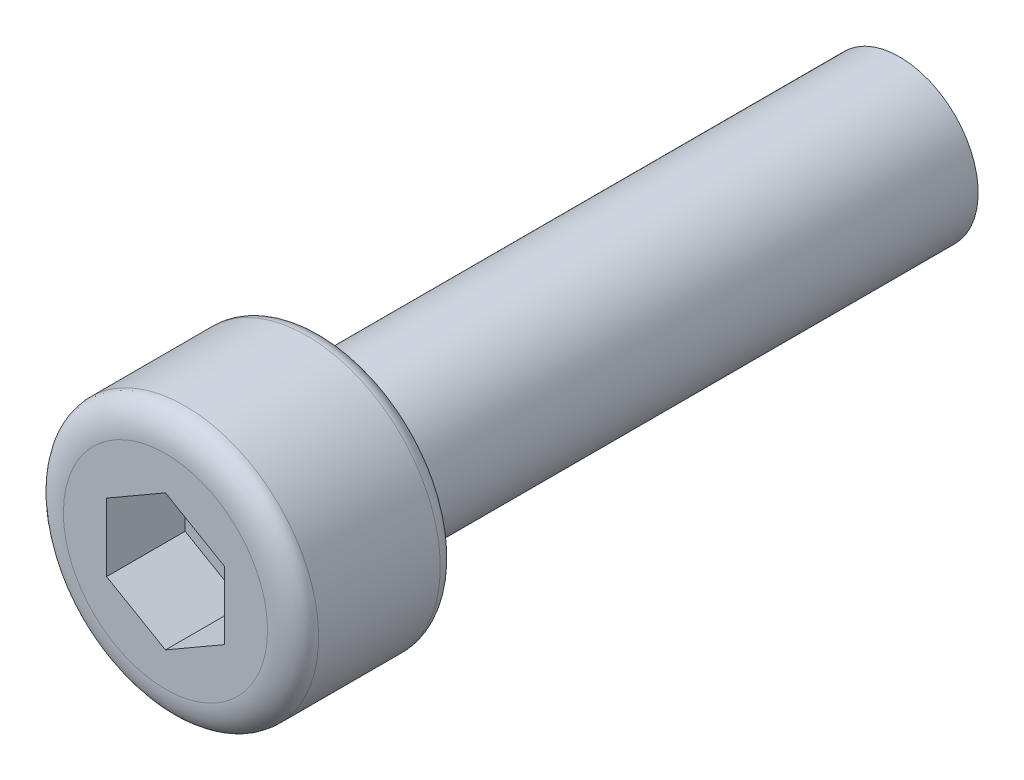
from build123d import *

# Parameters (mm, degrees)
CHAMFER_1_SIZE      = 0.3
CHAMFER_1_SIZE2     = 0.519615242
FILLET_1_R          = 0.4
FILLET_2_SIZE       = 0.5
FILLET_2_SIZE_2     = 0.8
CUT_EXTRUDE_1_DEPTH = 2


with BuildPart() as part:
    # 草图2 → 旋转1 (revolve)
    with BuildSketch(Plane(origin=(0, 0, 0), x_dir=(0, 0, -1), z_dir=(1, 0, 0)), mode=Mode.PRIVATE) as revolve_1_sk:
        Polygon((-9.5, 0), (-9.5, 3.4), (-5.5, 3.4), (-5.5, 2), (9.5, 2), (9.5, 0), align=None)
    revolve(revolve_1_sk.sketch.rotate(Axis((0, 0, -9.5), (0, 0, 1)), 90), axis=Axis((0, 0, -9.5), (0, 0, 1)))

    # 倒角1
    chamfer_1_edges = [part.edges().sort_by_distance(p)[0] for p in [
        (2, 0, -9.5),
    ]]
    chamfer_1_side = [part.faces().sort_by_distance(p)[0] for p in [
        (2, 0, -2),
    ]]
    chamfer(chamfer_1_edges, length=CHAMFER_1_SIZE, length2=CHAMFER_1_SIZE2, reference=chamfer_1_side[0])

    # 圆角1
    fillet_1_edges = [part.edges().sort_by_distance(p)[0] for p in [
        (3.4, 0, 5.5),
    ]]
    fillet(fillet_1_edges, radius=FILLET_1_R)

    # 圆角2
    # an asymmetric fillet: 0.8, 0.5 mm, written as the material it takes off along each edge
    with BuildSketch(Plane(origin=(0, 0, 9.5), x_dir=(-1, 0, 0), z_dir=(0, 1, 0))) as fillet_2_piece_1:
        with BuildLine():
            Bezier((3.4, -FILLET_2_SIZE), (3.4, 0), (3.4 - FILLET_2_SIZE_2, 0), weights=[1, 0.707106781, 1])
            Line((3.4 - FILLET_2_SIZE_2, 0), (3.4, 0))
            Line((3.4, 0), (3.4, -FILLET_2_SIZE))
        make_face()
    revolve(axis=Axis((0, 0, 9.5), (0, 0, 1)), mode=Mode.SUBTRACT)

    # 草图3 → 切除-拉伸1 (cut)
    with BuildSketch(Plane.XY.offset(9.5)):
        Polygon((0, 1.732050808), (-1.5, 0.866025404), (-1.5, -0.866025404), (0, -1.732050808), (1.5, -0.866025404), (1.5, 0.866025404), align=None)
    extrude(amount=-CUT_EXTRUDE_1_DEPTH, mode=Mode.SUBTRACT)


solid = part.part
